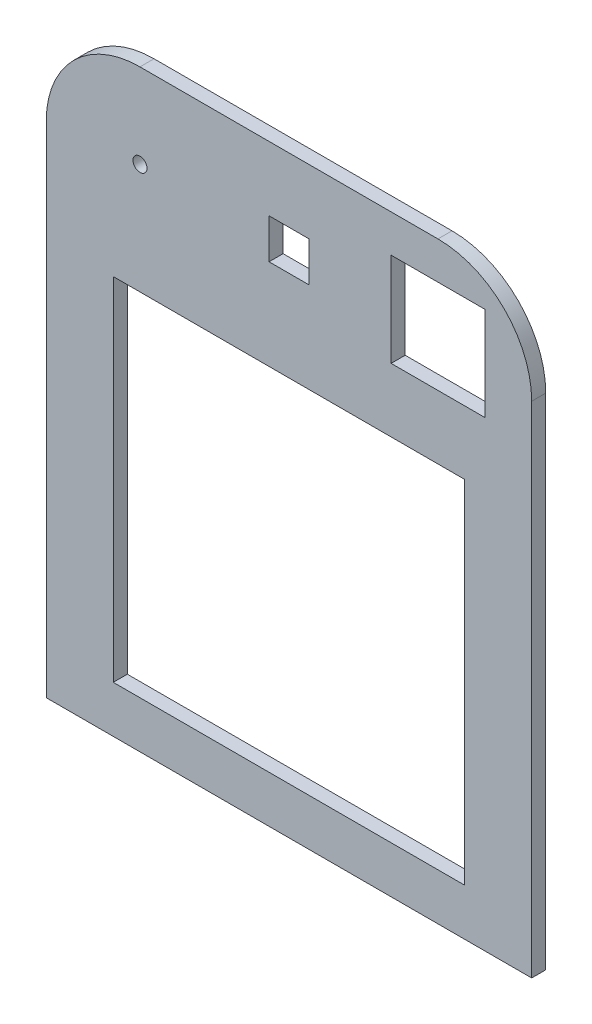
from build123d import *

# Parameters (mm, degrees)
SKETCH_1_W          = 103.6
SKETCH_1_H          = 126.6
EXTRUDE_1_DEPTH     = 3
SKETCH_2_R          = 1.5
SKETCH_2_W          = 75
SKETCH_2_H          = 75
SKETCH_2_W_2        = 8.5
SKETCH_2_H_2        = 8.5
SKETCH_2_W_3        = 20
SKETCH_2_H_3        = 20
CUT_EXTRUDE_1_DEPTH = 3
FILLET_3_R          = 20
FILLET_5_R          = 20


with BuildPart() as part:
    # 草图1 → 凸台-拉伸1 (new body)
    with BuildSketch(Plane.XY):
        Rectangle(SKETCH_1_W, SKETCH_1_H)
    extrude(amount=EXTRUDE_1_DEPTH)

    # 草图2 → 切除-拉伸1 (cut)
    with BuildSketch(Plane.XY.offset(3)):
        with Locations((-31.8, 45.3)):
            Circle(SKETCH_2_R)
        with Locations((0, -15.8)):
            Rectangle(SKETCH_2_W, SKETCH_2_H)
        with Locations((0, 45.3)):
            Rectangle(SKETCH_2_W_2, SKETCH_2_H_2)
        with Locations((31.8, 45.3)):
            Rectangle(SKETCH_2_W_3, SKETCH_2_H_3)
    extrude(amount=-CUT_EXTRUDE_1_DEPTH, mode=Mode.SUBTRACT)

    # 圆角3
    fillet_3_edges = [part.edges().sort_by_distance(p)[0] for p in [
        (51.8, 63.3, 1.5),
    ]]
    fillet(fillet_3_edges, radius=FILLET_3_R)

    # 圆角5
    fillet_5_edges = [part.edges().sort_by_distance(p)[0] for p in [
        (-51.8, 63.3, 1.5),
    ]]
    fillet(fillet_5_edges, radius=FILLET_5_R)


solid = part.part
